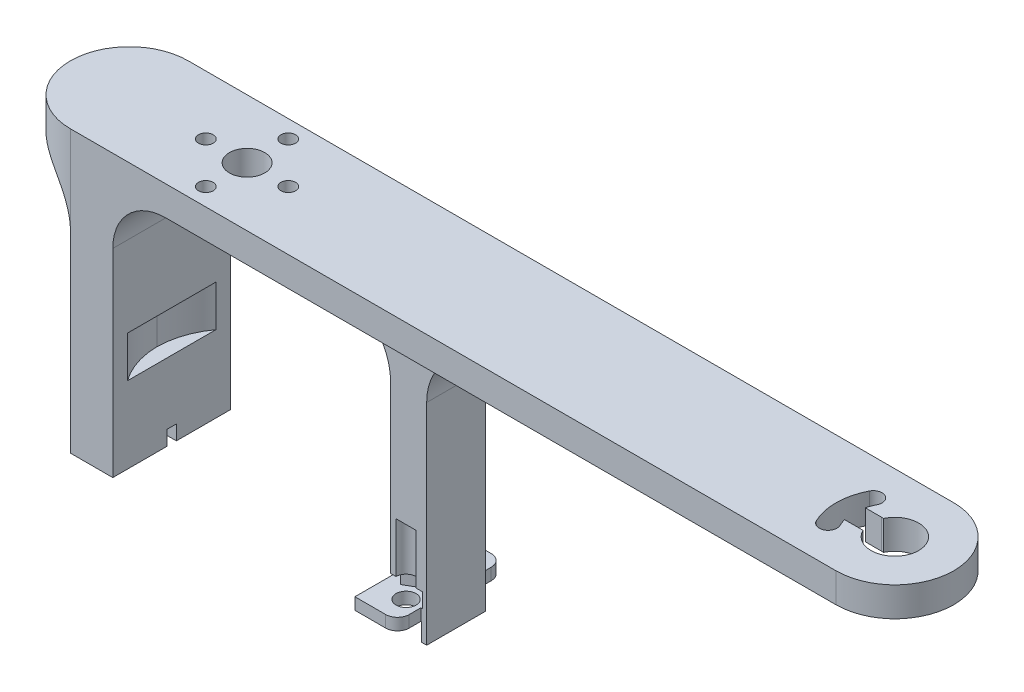
from build123d import *

# Parameters (mm, degrees)
BOSS_EXTRUDE1_DEPTH     = 5
SKETCH2_R               = 3
SKETCH2_R_2             = 1.25
CUT_EXTRUDE1_DEPTH      = 5
ENL_V_START             = -1.5
ESQUISSE5_R             = 1.7
ESQUISSE5_R_2           = 1.25
ENL_V_MAT_EXTRU_3_DEPTH = 1.5
ENL_V_MAT_EXTRU_2_DEPTH = 5
BOSS_EXTRU_1_DEPTH      = 42.7
BOSS_EXTRU_4_DEPTH      = 2
ESQUISSE12_W            = 0.850183254
ESQUISSE12_H            = 10
BOSS_EXTRU_9_DEPTH      = 3
ESQUISSE13_W            = 5.7
ESQUISSE13_H            = 1.6
ENL_V_MAT_EXTRU_4_DEPTH = 2.5
ESQUISSE12_3_R          = 1.7
CUT_EXTRUDE2_DEPTH      = 13
FILLET1_R               = 10
FILLET2_R               = 9
SKETCH10_R              = 1.7
CUT_EXTRUDE4_DEPTH      = 2.5
SKETCH9_W               = 6.5
SKETCH9_H               = 2.5
CUT_EXTRUDE3_DEPTH      = 3
SKETCH11_W              = 15
SKETCH11_H              = 7
CUT_EXTRUDE5_DEPTH      = 2.5
FILLET3_R               = 13


with BuildPart() as part:
    # Sketch1 → Boss-Extrude1 (new body)
    with BuildSketch(Plane(origin=(0, 0, 0), x_dir=(1, 0, 0), z_dir=(0, 1, 0))):
        with BuildLine():
            Line((0, 10), (110, 10))
            ThreePointArc((110, 10), (120, 0), (110, -10))
            Line((110, -10), (0, -10))
            Line((0, -10), (-10, -10))
            Line((-10, -10), (-20, -10))
            ThreePointArc((-20, -10), (-30, 0), (-20, 10))
            Line((-20, 10), (-10, 10))
            Line((-10, 10), (0, 10))
        make_face()
    extrude(amount=BOSS_EXTRUDE1_DEPTH)

    # Sketch2 → Cut-Extrude1 (cut)
    with BuildSketch(Plane(origin=(0, 5, 0), x_dir=(1, 0, 0), z_dir=(0, 1, 0))):
        with Locations(Location((0, 0, 0), (0, 0, 270))):
            Circle(SKETCH2_R)
        with Locations(Location((7, 0, 0), (0, 0, 270))):
            Circle(SKETCH2_R_2)
        with Locations(Location((-7, 0, 0), (0, 0, 270))):
            Circle(SKETCH2_R_2)
        with Locations(Location((0, -7, 0), (0, 0, 270))):
            Circle(SKETCH2_R_2)
        with Locations(Location((0, 7, 0), (0, 0, 270))):
            Circle(SKETCH2_R_2)
    extrude(amount=-CUT_EXTRUDE1_DEPTH, mode=Mode.SUBTRACT)

    # Esquisse5 → Enlèv. mat.-Extru.3 (cut)
    # profile 1 of 4: a face of its own
    with BuildSketch(Plane.XZ.offset(ENL_V_START)):
        with Locations(Location((0, 7, 0), (0, 0, 270))):
            Circle(ESQUISSE5_R)
        with Locations(Location((0, 7, 0), (0, 0, 90))):
            Circle(ESQUISSE5_R_2, mode=Mode.SUBTRACT)
    # profile 2 of 4: a face of its own
    with BuildSketch(Plane.XZ.offset(ENL_V_START)):
        with Locations(Location((7, 0, 0), (0, 0, 270))):
            Circle(ESQUISSE5_R)
        with Locations(Location((7, 0, 0), (0, 0, 90))):
            Circle(ESQUISSE5_R_2, mode=Mode.SUBTRACT)
    # profile 3 of 4: a face of its own
    with BuildSketch(Plane.XZ.offset(ENL_V_START)):
        with Locations(Location((0, -7, 0), (0, 0, 270))):
            Circle(ESQUISSE5_R)
        with Locations(Location((0, -7, 0), (0, 0, 90))):
            Circle(ESQUISSE5_R_2, mode=Mode.SUBTRACT)
    # profile 4 of 4: a face of its own
    with BuildSketch(Plane.XZ.offset(ENL_V_START)):
        with Locations(Location((-7, 0, 0), (0, 0, 270))):
            Circle(ESQUISSE5_R)
        with Locations(Location((-7, 0, 0), (0, 0, 90))):
            Circle(ESQUISSE5_R_2, mode=Mode.SUBTRACT)
    extrude(amount=ENL_V_MAT_EXTRU_3_DEPTH, mode=Mode.SUBTRACT)

    # Esquisse2 → Enlèv. mat.-Extru.2 (cut)
    with BuildSketch(Plane.XZ):
        with BuildLine():
            Line((103.222279144, -1.75), (105.95, -1.75))
            ThreePointArc((105.95, -1.75), (106.140169379, -1.739636631), (106.32808642, -1.708669266))
            ThreePointArc((106.32808642, -1.708669266), (114.04993552, -0.022853594), (106.347603526, 1.75))
            Line((106.347603526, 1.75), (105.95, 1.75))
            Line((105.95, 1.75), (103.222279144, 1.75))
            ThreePointArc((103.222279144, 1.75), (103.42200027, 2.393725037), (103.682704884, 3.015258266))
            ThreePointArc((103.682704884, 3.015258266), (102.975125558, 5.015091134), (100.975292691, 4.307511809))
            ThreePointArc((100.975292691, 4.307511809), (100.001081462, -0.14706488), (101.105879472, -4.571063338))
            ThreePointArc((101.105879472, -4.571063338), (103.125657052, -5.219521916), (103.774115631, -3.199744337))
            ThreePointArc((103.774115631, -3.199744337), (103.457914944, -2.490205439), (103.222279144, -1.75))
        make_face()
    extrude(amount=-ENL_V_MAT_EXTRU_2_DEPTH, mode=Mode.SUBTRACT)

    # Esquisse6 → Boss.-Extru.1 (add)
    with BuildSketch(Plane.XZ):
        Polygon((-12.8, -9.6), (-12.8, -10), (-20, -10), (-20, 10), (-12.8, 10), (-12.8, 9.6), (-12.8, 7.332121112), (-12.8, -7.332121112), align=None)
        Polygon((29.370183254, 5), (34.370183254, 5), (35.500183254, 5), (35.500183254, -5), (34.370183254, -5), (29.370183254, -5), align=None)
    extrude(amount=BOSS_EXTRU_1_DEPTH)

    # Esquisse9 → Boss.-Extru.4 (add)
    with BuildSketch(Plane.XZ.offset(42.7)):
        with BuildLine():
            Line((32.5, 8.961608693), (27.273089502, 8.961608693))
            Line((27.273089502, 8.961608693), (27.273089502, -8.961608693))
            Line((27.273089502, -8.961608693), (32.5, -8.961608693))
            ThreePointArc((32.5, -8.961608693), (33.914213562, -8.375822255), (34.5, -6.961608693))
            Line((34.5, -6.961608693), (34.5, -5.222560863))
            Line((34.5, -5.222560863), (34.5, -3.746626422))
            Line((34.5, -3.746626422), (34.5, 4.59257943))
            Line((34.5, 4.59257943), (34.5, 5.222560863))
            Line((34.5, 5.222560863), (34.5, 6.961608693))
            ThreePointArc((34.5, 6.961608693), (33.914213562, 8.375822255), (32.5, 8.961608693))
        make_face()
        with BuildLine():
            Line((-12.8, 8.961608693), (-18, 8.961608693))
            ThreePointArc((-18, 8.961608693), (-19.414213562, 8.375822255), (-20, 6.961608693))
            Line((-20, 6.961608693), (-20, 5.222560863))
            Line((-20, 5.222560863), (-20, 4.59257943))
            Line((-20, 4.59257943), (-20, -3.746626422))
            Line((-20, -3.746626422), (-20, -5.222560863))
            Line((-20, -5.222560863), (-20, -6.961608693))
            ThreePointArc((-20, -6.961608693), (-19.414213562, -8.375822255), (-18, -8.961608693))
            Line((-18, -8.961608693), (-12.8, -8.961608693))
            Line((-12.8, -8.961608693), (-12.8, 8.961608693))
        make_face()
    extrude(amount=-BOSS_EXTRU_4_DEPTH)

    # Esquisse12 → Boss.-Extru.9 (add)
    with BuildSketch(Plane.XZ.offset(42.7)):
        with Locations((35.075091627, 0)):
            Rectangle(ESQUISSE12_W, ESQUISSE12_H)
    extrude(amount=BOSS_EXTRU_9_DEPTH)

    # Esquisse13 → Enlèv. mat.-Extru.4 (cut)
    with BuildSketch(Plane.XZ.offset(42.7)):
        with Locations((30.123089502, 0)):
            Rectangle(ESQUISSE13_W, ESQUISSE13_H)
        with Locations((-15.65, 0)):
            Rectangle(ESQUISSE13_W, ESQUISSE13_H)
    extrude(amount=-ENL_V_MAT_EXTRU_4_DEPTH, mode=Mode.SUBTRACT)

    # Esquisse12<3> → Cut-Extrude2 (cut)
    with BuildSketch(Plane.XZ.offset(42.7)):
        with Locations(Location((32.000000052, 5, 0), (0, 0, 270))):
            Circle(ESQUISSE12_3_R)
        with Locations(Location((32.000000017, -5, 0), (0, 0, 270))):
            Circle(ESQUISSE12_3_R)
        with Locations(Location((-17.500000017, -5.000000014, 0), (0, 0, 270))):
            Circle(ESQUISSE12_3_R)
        with Locations(Location((-17.500000084, 5.000000043, 0), (0, 0, 270))):
            Circle(ESQUISSE12_3_R)
    extrude(amount=-CUT_EXTRUDE2_DEPTH, mode=Mode.SUBTRACT)

    # Fillet1
    # the kernel refuses this fillet: 10 mm, written as the material it adds along each edge
    with BuildSketch(Plane(origin=(-20, 0, -35), x_dir=(0, -1, 0), z_dir=(0, 0, 1))) as fillet1_piece_1_section:
        with BuildLine():
            CenterArc((FILLET1_R, -FILLET1_R), FILLET1_R, 90, 90)
            Line((0, -FILLET1_R), (0, 0))
            Line((0, 0), (FILLET1_R, 0))
        make_face()
    fillet1_piece_1 = extrude(amount=70, mode=Mode.PRIVATE)
    fillet1_piece_1 = fillet1_piece_1 & Plane(origin=(-20, -2.301897374, 0), x_dir=(0, 0, 1), z_dir=(0, -1, 0)) * Cylinder(10, 181, mode=Mode.PRIVATE)
    add(fillet1_piece_1)
    with BuildSketch(Plane(origin=(35.500183254, 0, 5), x_dir=(1, 0, 0), z_dir=(0, 0, -1)), Plane(origin=(29.370183254, 0, -5), x_dir=(-1, 0, 0), z_dir=(0, 0, 1))) as fillet1_piece_2:
        with BuildLine():
            CenterArc((FILLET1_R, FILLET1_R), FILLET1_R, 180, 90)
            Line((0, FILLET1_R), (0, 0))
            Line((0, 0), (FILLET1_R, 0))
        make_face()
    extrude(amount=10)

    # Fillet2
    # the kernel refuses this fillet: 9 mm, written as the material it adds along each edge
    with BuildSketch(Plane(origin=(-12.8, 0, -10), x_dir=(1, 0, 0), z_dir=(0, 0, 1))) as fillet2_piece_1_section:
        with BuildLine():
            CenterArc((FILLET2_R, -FILLET2_R), FILLET2_R, 90, 90)
            Line((0, -FILLET2_R), (0, 0))
            Line((0, 0), (FILLET2_R, 0))
        make_face()
    fillet2_piece_1 = extrude(amount=20, mode=Mode.PRIVATE)
    fillet2_piece_1 = fillet2_piece_1 - Plane(origin=(-7, -2.069430127, 0), x_dir=(0, 0, -1), z_dir=(0, 1, 0)) * Cylinder(1.7, 77, mode=Mode.PRIVATE)
    add(fillet2_piece_1)

    # Sketch10 → Cut-Extrude4 (cut)
    # profile 1 of 4: a face of its own
    with BuildSketch(Plane(origin=(0, -40.7, 0), x_dir=(1, 0, 0), z_dir=(0, 1, 0))):
        Polygon((32.000000017, 8.233161507), (29.200000017, 6.616580754), (29.200000017, 3.383419246), (32.000000017, 1.766838493), (34.800000017, 3.383419246), (34.800000017, 6.616580754), align=None)
        with Locations(Location((32.000000017, 5, 0), (0, 0, 90))):
            Circle(SKETCH10_R, mode=Mode.SUBTRACT)
    # profile 2 of 4: a face of its own
    with BuildSketch(Plane(origin=(0, -40.7, 0), x_dir=(1, 0, 0), z_dir=(0, 1, 0))):
        Polygon((29.200000052, -6.616580754), (32.000000052, -8.233161507), (34.800000052, -6.616580754), (34.800000052, -3.383419246), (32.000000052, -1.766838493), (29.200000052, -3.383419246), align=None)
        with Locations(Location((32.000000052, -5, 0), (0, 0, 90))):
            Circle(SKETCH10_R, mode=Mode.SUBTRACT)
    # profile 3 of 4: a face of its own
    with BuildSketch(Plane(origin=(0, -40.7, 0), x_dir=(1, 0, 0), z_dir=(0, 1, 0))):
        Polygon((-20.300000084, -3.383419289), (-20.300000084, -6.616580796), (-17.500000084, -8.23316155), (-14.700000084, -6.616580796), (-14.700000084, -3.383419289), (-17.500000084, -1.766838535), align=None)
        with Locations(Location((-17.500000084, -5.000000043, 0), (0, 0, 90))):
            Circle(SKETCH10_R, mode=Mode.SUBTRACT)
    # profile 4 of 4: a face of its own
    with BuildSketch(Plane(origin=(0, -40.7, 0), x_dir=(1, 0, 0), z_dir=(0, 1, 0))):
        Polygon((-14.700000017, 6.616580768), (-17.500000017, 8.233161522), (-20.300000017, 6.616580768), (-20.300000017, 3.383419261), (-17.500000017, 1.766838507), (-14.700000017, 3.383419261), align=None)
        with Locations(Location((-17.500000017, 5.000000014, 0), (0, 0, 90))):
            Circle(SKETCH10_R, mode=Mode.SUBTRACT)
    extrude(amount=CUT_EXTRUDE4_DEPTH, mode=Mode.SUBTRACT)

    # Sketch9 → Cut-Extrude3 (cut)
    with BuildSketch(Plane.ZY.offset(20)):
        with Locations((-4.983756338, -39.45)):
            Rectangle(SKETCH9_W, SKETCH9_H)
        with Locations((4.986788214, -39.45)):
            Rectangle(SKETCH9_W, SKETCH9_H)
    extrude(amount=-CUT_EXTRUDE3_DEPTH, mode=Mode.SUBTRACT)

    # Sketch11 → Cut-Extrude5 (cut)
    with BuildSketch(Plane(origin=(-12.8, 0, 0), x_dir=(0, 0, -1), z_dir=(1, 0, 0))):
        with Locations((0, -26.2)):
            Rectangle(SKETCH11_W, SKETCH11_H)
    extrude(amount=-CUT_EXTRUDE5_DEPTH, mode=Mode.SUBTRACT)

    # Fillet3
    # the kernel refuses this fillet: 13 mm, written as the material it adds along each edge
    with BuildSketch(Plane(origin=(-15.3, -3.537862854, -7.5), x_dir=(1, 0, 0), z_dir=(0, -1, 0)), Plane(origin=(-15.3, -29.7, 7.5), x_dir=(1, 0, 0), z_dir=(0, 1, 0))) as fillet3_piece_1:
        with BuildLine():
            CenterArc((13, 7.664854858), FILLET3_R, 180, 36.128927472)
            Line((0, 7.664854858), (-0.26, 7.664854858))
            Line((-0.26, 7.664854858), (-0.26, 0))
            Line((-0.26, 0), (0, -0.26))
            ThreePointArc((0, -0.26), (1.25, -0.26), (2.29, -0.153297097))
            Line((2.29, -0.153297097), (2.5, 0))
        make_face()
    extrude(amount=26.162137146)


solid = part.part
